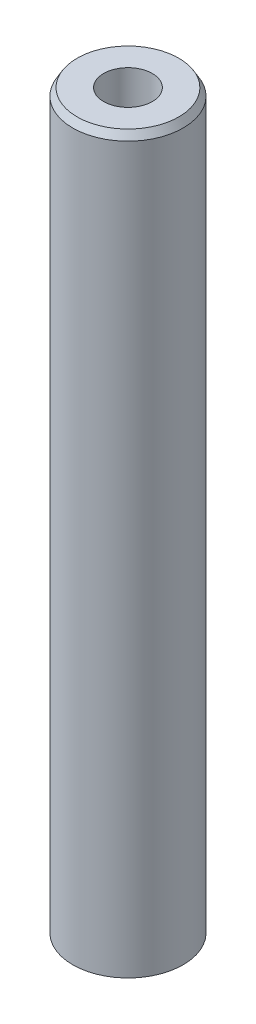
from build123d import *
from OCP.BRepFilletAPI import BRepFilletAPI_MakeChamfer

# Parameters (mm, degrees)
SKETCH1_R           = 10
BOSS_EXTRUDE1_DEPTH = 133.387566287
SKETCH2_R           = 4.412279594
CUT_EXTRUDE1_DEPTH  = 135.135166306
CHAMFER1_SIZE       = 1.350121974
CHAMFER1_SIZE2      = 0.786198645


with BuildPart() as part:
    # Sketch1 → Boss-Extrude1 (new body)
    with BuildSketch(Plane(origin=(0, 0, 0), x_dir=(1, 0, 0), z_dir=(0, 1, 0))):
        Circle(SKETCH1_R)
    extrude(amount=BOSS_EXTRUDE1_DEPTH)

    # Sketch2 → Cut-Extrude1 (cut, through all)
    with BuildSketch(Plane(origin=(0, 0, 0), x_dir=(1, 0, 0), z_dir=(0, 1, 0))):
        Circle(SKETCH2_R)
    extrude(amount=CUT_EXTRUDE1_DEPTH, mode=Mode.SUBTRACT)

    # Chamfer1: one chamfer whose edges measure the first distance from different faces: ONE call of the kernel's chamfer builder (chamfer() names one face for all edges)
    chamfer1_edges_1 = [part.edges().sort_by_distance(p)[0] for p in [
        (-10, 133.387566287, 0),
    ]]
    chamfer1_side_1 = [part.faces().sort_by_distance(p)[0] for p in [
        (-10, 66.693783143, 0),
    ]]
    chamfer1_edges_2 = [part.edges().sort_by_distance(p)[0] for p in [
        (-10, 0, 0),
    ]]
    chamfer1_side_2 = [part.faces().sort_by_distance(p)[0] for p in [
        (-9.717157288, 0, 0),
    ]]
    chamfer1 = BRepFilletAPI_MakeChamfer(part.part.solid().wrapped)
    for e in chamfer1_edges_1:
        chamfer1.Add(CHAMFER1_SIZE, CHAMFER1_SIZE2, e.wrapped, chamfer1_side_1[0].wrapped)  # the first distance lies on this face
    for e in chamfer1_edges_2:
        chamfer1.Add(CHAMFER1_SIZE, CHAMFER1_SIZE2, e.wrapped, chamfer1_side_2[0].wrapped)  # the first distance lies on this face
    add(Compound.cast(chamfer1.Shape()), mode=Mode.REPLACE)


solid = part.part
